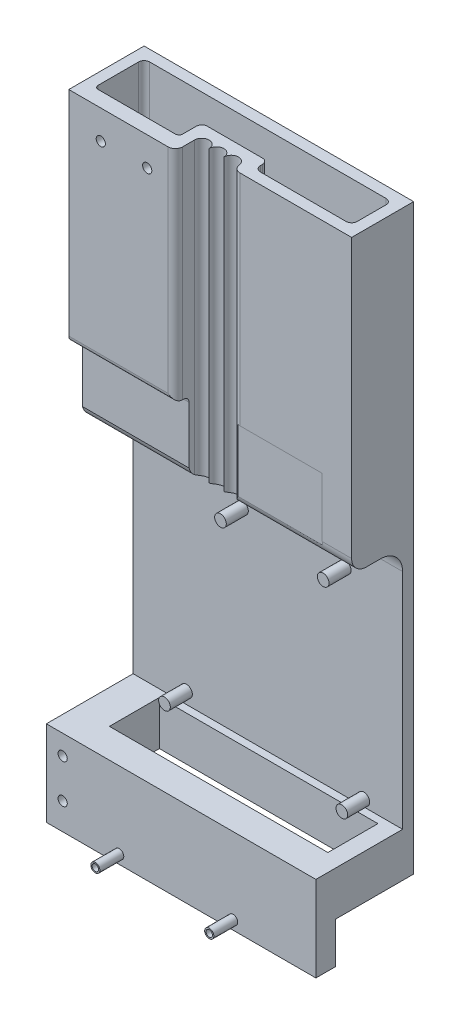
from build123d import *
from OCP.BRepAlgoAPI import BRepAlgoAPI_Cut
from OCP.TopTools import TopTools_ListOfShape

# Parameters (mm, degrees)
SKETCH1_W                      = 73.34
SKETCH1_H                      = 169.657257597
BOSS_EXTRUDE1_DEPTH            = 3
SKETCH9_W                      = 73.34
SKETCH9_H                      = 79.670461067
BOSS_EXTRUDE4_DEPTH            = 17.5
CUT_EXTRUDE1_DEPTH             = 173.631306068
CUT_EXTRUDE2_DEPTH             = 73.670461067
SKETCH12_W                     = 20.775343783
SKETCH12_H                     = 3.735015603
CUT_EXTRUDE3_DEPTH             = 76
FILLET1_START                  = -66
FILLET1_DEPTH                  = 75
FILLET1_START_2                = -65.34
FILLET1_2_DEPTH                = 29
FILLET1_3_DEPTH                = 75
FILLET1_4_DEPTH                = 73.34
FILLET1_START_3                = 79.469382503
FILLET1_5_DEPTH                = 79.530617497
SKETCH13_W                     = 73.34
SKETCH13_H                     = 23.237135262
BOSS_EXTRUDE5_DEPTH            = 26.6
CUT_EXTRUDE4_DEPTH             = 177.630455701
CUT_EXTRUDE4_DEPTH_BACK        = 177.630455701
SKETCH14_W                     = 21.32937166
SKETCH14_H                     = 11.18958823
SKETCH18_W                     = 59.458192731
SKETCH18_H                     = 13.611975131
CUT_EXTRUDE5_DEPTH             = 15.5
BOSS_EXTRUDE6_START            = -8.965684
SKETCH20_R                     = 1.23951459
BOSS_EXTRUDE6_DEPTH            = 6.5
SKETCH20_R_2                   = 1.25
BOSS_EXTRUDE6_2_DEPTH          = 6.5
SKETCH2_R                      = 1.5875
SKETCH2_R_2                    = 1.58375263
BOSS_EXTRUDE7_DEPTH            = 6
M3X0_5_TAPPED_HOLE1_AT_2_COUNT = 2
M3X0_5_TAPPED_HOLE1_AT_2_PITCH = 10.583256094
M3X0_5_TAPPED_HOLE2_AT_2_COUNT = 2
M3X0_5_TAPPED_HOLE2_AT_2_PITCH = 12.630996486


with BuildPart() as part:
    # Sketch1 → Boss-Extrude1 (new body)
    with BuildSketch(Plane.XY):
        with Locations((-28.67, 73.639040569)):
            Rectangle(SKETCH1_W, SKETCH1_H)
    extrude(amount=BOSS_EXTRUDE1_DEPTH)

    # Sketch9 → Boss-Extrude4 (add)
    with BuildSketch(Plane.XY.offset(3)):
        with Locations((-28.67, 118.632438834)):
            Rectangle(SKETCH9_W, SKETCH9_H)
    extrude(amount=BOSS_EXTRUDE4_DEPTH)

    # Sketch10 → Cut-Extrude1 (cut, through all)
    with BuildSketch(Plane.XZ):
        with BuildLine():
            ThreePointArc((-32.34, 15.308727806), (-30.34, 13.308727806), (-28.34, 15.308727806))
            ThreePointArc((-28.34, 15.308727806), (-26.34, 13.308727806), (-24.34, 15.308727806))
            Line((-24.34, 15.308727806), (-24.34, 16.87))
            Line((-24.34, 16.87), (8, 16.87))
            Line((8, 16.87), (8, 20.5))
            Line((8, 20.5), (-36.34, 20.5))
            Line((-36.34, 20.5), (-36.34, 16.87))
            Line((-36.34, 16.87), (-36.34, 15.308727806))
            ThreePointArc((-36.34, 15.308727806), (-34.34, 13.308727806), (-32.34, 15.308727806))
        make_face()
    extrude(amount=-CUT_EXTRUDE1_DEPTH, mode=Mode.SUBTRACT)

    # Sketch11 → Cut-Extrude2 (cut)
    with BuildSketch(Plane(origin=(0, 158.467669367, 0), x_dir=(1, 0, 0), z_dir=(0, 1, 0))):
        with BuildLine():
            Line((-39.34, -3), (-60.84, -3))
            ThreePointArc((-60.84, -3), (-61.900660172, -3.439339828), (-62.34, -4.5))
            Line((-62.34, -4.5), (-62.34, -15.5))
            ThreePointArc((-62.34, -15.5), (-62.047106781, -16.207106781), (-61.34, -16.5))
            Line((-61.34, -16.5), (-40.34, -16.5))
            ThreePointArc((-40.34, -16.5), (-39.632893219, -16.207106781), (-39.34, -15.5))
            Line((-39.34, -15.5), (-39.34, -11.808727806))
            ThreePointArc((-39.34, -11.808727806), (-38.900660172, -10.748067634), (-37.84, -10.308727806))
            Line((-37.84, -10.308727806), (-22.84, -10.308727806))
            ThreePointArc((-22.84, -10.308727806), (-21.779339828, -10.748067634), (-21.34, -11.808727806))
            Line((-21.34, -11.808727806), (-21.34, -12.37))
            ThreePointArc((-21.34, -12.37), (-20.900660172, -13.430660172), (-19.84, -13.87))
            Line((-19.84, -13.87), (3.5, -13.87))
            ThreePointArc((3.5, -13.87), (4.560660172, -13.430660172), (5, -12.37))
            Line((5, -12.37), (5, -4.5))
            ThreePointArc((5, -4.5), (4.560660172, -3.439339828), (3.5, -3))
            Line((3.5, -3), (-21.34, -3))
            Line((-21.34, -3), (-39.34, -3))
        make_face()
    extrude(amount=-CUT_EXTRUDE2_DEPTH, mode=Mode.SUBTRACT)

    # Sketch12 → Cut-Extrude3 (cut)
    with BuildSketch(Plane.YZ):
        with Locations((88.482016522, 18.632492199)):
            Rectangle(SKETCH12_W, SKETCH12_H)
    extrude(amount=-CUT_EXTRUDE3_DEPTH, mode=Mode.SUBTRACT)

    # Fillet1: read off the stored shape, not the designer's step
    # Fillet1 outline → Fillet1 (cut)
    with BuildSketch(Plane.YZ.offset(FILLET1_START)):
        with BuildLine():
            Line((78.7972083, 16.764984397), (78.7972083, 12.87))
            ThreePointArc((78.7972083, 12.87), (79.663345702, 15.355740377), (81.886660911, 16.764984397))
            Line((81.886660911, 16.764984397), (78.7972083, 16.764984397))
        make_face()
    extrude(amount=FILLET1_DEPTH, mode=Mode.SUBTRACT)

    # Fillet1 2 outline → Fillet1 2 (add)
    with BuildSketch(Plane.YZ.offset(FILLET1_START_2)):
        with BuildLine():
            ThreePointArc((98.869688413, 18.264984397), (98.430348584, 17.204324226), (97.369688413, 16.764984397))
            Line((97.369688413, 16.764984397), (98.869688413, 16.764984397))
            Line((98.869688413, 16.764984397), (98.869688413, 18.264984397))
        make_face()
    extrude(amount=FILLET1_2_DEPTH)

    # Fillet1 3 outline → Fillet1 3 (cut)
    with BuildSketch(Plane.YZ.offset(FILLET1_START)):
        with BuildLine():
            ThreePointArc((98.869688413, 19), (99.309028241, 20.060660172), (100.369688413, 20.5))
            Line((100.369688413, 20.5), (98.869688413, 20.5))
            Line((98.869688413, 20.5), (98.869688413, 19))
        make_face()
        with BuildLine():
            Line((78.7972083, 16.764984397), (81.886660911, 16.764984397))
            ThreePointArc((81.886660911, 16.764984397), (82.338916683, 16.843659371), (82.7972083, 16.87))
            Line((82.7972083, 16.87), (78.7972083, 16.87))
            Line((78.7972083, 16.87), (78.7972083, 16.764984397))
        make_face()
    extrude(amount=FILLET1_3_DEPTH, mode=Mode.SUBTRACT)

    # Fillet1 4 outline → Fillet1 4 (add)
    with BuildSketch(Plane.YZ.offset(FILLET1_START_2)):
        with BuildLine():
            Line((78.7972083, 3), (78.7972083, 9))
            ThreePointArc((78.7972083, 9), (77.039848987, 4.757359313), (72.7972083, 3))
            Line((72.7972083, 3), (78.7972083, 3))
        make_face()
    extrude(amount=FILLET1_4_DEPTH)

    # Fillet1 5 outline → Fillet1 5 (cut)
    with BuildSketch(Plane(origin=(0, 0, 0), x_dir=(1, 0, 0), z_dir=(0, 1, 0)).offset(FILLET1_START_3)):
        with BuildLine():
            Line((-24.34, -16.87), (-22.364133062, -16.87))
            ThreePointArc((-22.364133062, -16.87), (-23.698537771, -16.359753024), (-24.352066512, -15.089364072))
            ThreePointArc((-24.352066512, -15.089364072), (-24.343018906, -15.198880129), (-24.34, -15.308727806))
            Line((-24.34, -15.308727806), (-24.34, -16.87))
        make_face()
        with BuildLine():
            ThreePointArc((-36.34, -18.5), (-36.925786438, -19.914213562), (-38.34, -20.5))
            Line((-38.34, -20.5), (-36.34, -20.5))
            Line((-36.34, -20.5), (-36.34, -18.5))
        make_face()
    extrude(amount=FILLET1_5_DEPTH, mode=Mode.SUBTRACT)

    # Sketch13 → Boss-Extrude5 (add)
    with BuildSketch(Plane.XY):
        with Locations((-28.67, 0.428979401)):
            Rectangle(SKETCH13_W, SKETCH13_H)
    extrude(amount=BOSS_EXTRUDE5_DEPTH)

    # Sketch14 → Cut-Extrude4 (cut, two sides: drawn at the far end of the back side and taken through both)
    with BuildSketch(Plane(origin=(8, 0, 0), x_dir=(0, 0, -1), z_dir=(1, 0, 0)).offset(-CUT_EXTRUDE4_DEPTH_BACK)):
        with Locations((-10.66468583, -5.594794115)):
            Rectangle(SKETCH14_W, SKETCH14_H)
    extrude(amount=CUT_EXTRUDE4_DEPTH + CUT_EXTRUDE4_DEPTH_BACK, mode=Mode.SUBTRACT)

    # Sketch18 → Cut-Extrude5 (cut)
    with BuildSketch(Plane(origin=(0, 0, 0), x_dir=(-1, 0, 0), z_dir=(0, -1, 0))):
        with Locations((26.427356062, -11.823696784)):
            Rectangle(SKETCH18_W, SKETCH18_H)
    extrude(amount=-CUT_EXTRUDE5_DEPTH, mode=Mode.SUBTRACT)


with BuildPart() as body_2:
    # Sketch20 → Boss-Extrude6 (new body)
    with BuildSketch(Plane.XY.offset(35.565684349).offset(BOSS_EXTRUDE6_START)):
        with Locations(Location((-45.512465678, -8.699989093, 0), (0, 0, 180))):
            Circle(SKETCH20_R)
    extrude(amount=BOSS_EXTRUDE6_DEPTH)


with BuildPart() as body_3:
    # Sketch20 → Boss-Extrude6 2 (new body)
    with BuildSketch(Plane.XY.offset(35.565684349).offset(BOSS_EXTRUDE6_START)):
        with Locations(Location((-14.513794536, -8.68958823, 0), (0, 0, 180))):
            Circle(SKETCH20_R_2)
    extrude(amount=BOSS_EXTRUDE6_2_DEPTH)


with BuildPart() as m2_2x0_45_tapped_hole1_tool:
    # Sketch24 → M2.2x0.45 Tapped Hole1 (revolve)
    with BuildSketch(Plane(origin=(-45.512465678, -8.699989093, 33.1), x_dir=(0, -1, 0), z_dir=(1, 0, 0))):
        Polygon((0, 0), (0, 7.275753042), (0.875, 6.75), (0.875, 0), align=None)
    revolve(axis=Axis((-45.512465678, -8.699989093, 39.45), (0, 0, -1)))


with BuildPart() as body_2_1:
    add(body_2.part)

    # M2.2x0.45 Tapped Hole1: cut by m2_2x0_45_tapped_hole1_tool, with a tolerance
    m2_2x0_45_tapped_hole1_stock = TopTools_ListOfShape()
    m2_2x0_45_tapped_hole1_stock.Append(body_2_1.part.wrapped)
    m2_2x0_45_tapped_hole1_tools = TopTools_ListOfShape()
    m2_2x0_45_tapped_hole1_tools.Append(m2_2x0_45_tapped_hole1_tool.part.wrapped)
    m2_2x0_45_tapped_hole1_cut = BRepAlgoAPI_Cut()
    m2_2x0_45_tapped_hole1_cut.SetArguments(m2_2x0_45_tapped_hole1_stock)
    m2_2x0_45_tapped_hole1_cut.SetTools(m2_2x0_45_tapped_hole1_tools)
    m2_2x0_45_tapped_hole1_cut.SetFuzzyValue(0.00001)
    m2_2x0_45_tapped_hole1_cut.Build()
    add(Compound.cast(m2_2x0_45_tapped_hole1_cut.Shape()).solids(), mode=Mode.REPLACE)


with BuildPart() as m2_2x0_45_tapped_hole2_tool:
    # Sketch27 → M2.2x0.45 Tapped Hole2 (revolve)
    with BuildSketch(Plane(origin=(-14.513794536, -8.68958823, 33.1), x_dir=(0, -1, 0), z_dir=(1, 0, 0))):
        Polygon((0, 0), (0, 7.275753042), (0.875, 6.75), (0.875, 0), align=None)
    revolve(axis=Axis((-14.513794536, -8.68958823, 39.45), (0, 0, -1)))


with BuildPart() as part_1:
    add(part.part)

    # M2.2x0.45 Tapped Hole2: cut by m2_2x0_45_tapped_hole2_tool, with a tolerance
    m2_2x0_45_tapped_hole2_stock = TopTools_ListOfShape()
    m2_2x0_45_tapped_hole2_stock.Append(part_1.part.wrapped)
    m2_2x0_45_tapped_hole2_tools = TopTools_ListOfShape()
    m2_2x0_45_tapped_hole2_tools.Append(m2_2x0_45_tapped_hole2_tool.part.wrapped)
    m2_2x0_45_tapped_hole2_cut = BRepAlgoAPI_Cut()
    m2_2x0_45_tapped_hole2_cut.SetArguments(m2_2x0_45_tapped_hole2_stock)
    m2_2x0_45_tapped_hole2_cut.SetTools(m2_2x0_45_tapped_hole2_tools)
    m2_2x0_45_tapped_hole2_cut.SetFuzzyValue(0.00001)
    m2_2x0_45_tapped_hole2_cut.Build()
    add(Compound.cast(m2_2x0_45_tapped_hole2_cut.Shape()).solids(), mode=Mode.REPLACE)

    # Sketch2 → Boss-Extrude7 (add)
    with BuildSketch(Plane.XY.offset(3)):
        with Locations((-2.54, 13.97)):
            Circle(SKETCH2_R)
        with Locations((-35.563579412, 66.03889068)):
            Circle(SKETCH2_R_2)
        with Locations((-50.8, 15.24)):
            Circle(SKETCH2_R)
        with Locations((-7.62, 66.04)):
            Circle(SKETCH2_R)
    extrude(amount=BOSS_EXTRUDE7_DEPTH)

    # Sketch29 → M3x0.5 Tapped Hole1 (revolve, cut)
    with BuildSketch(Plane(origin=(-60.900206077, 6.673342436, 26.6), x_dir=(0, -1, 0), z_dir=(1, 0, 0))):
        Polygon((0, 0), (0, 5.351075774), (1.25, 4.6), (1.25, 0), align=None)
    m3x0_5_tapped_hole1 = revolve(axis=Axis((-60.900206077, 6.673342436, 32.95), (0, 0, -1)), mode=Mode.SUBTRACT)

    # M3x0.5 Tapped Hole1 at 2: M3x0.5 Tapped Hole1 ×2
    with Locations(*[(0, -i * M3X0_5_TAPPED_HOLE1_AT_2_PITCH, 0) for i in range(1, M3X0_5_TAPPED_HOLE1_AT_2_COUNT)]):
        add(m3x0_5_tapped_hole1, mode=Mode.SUBTRACT)

    # Sketch32 → M3x0.5 Tapped Hole2 (revolve, cut)
    with BuildSketch(Plane(origin=(-56.6297997, 150.625949834, 20.5), x_dir=(0, -1, 0), z_dir=(1, 0, 0))):
        Polygon((0, 0), (0, 5.351075774), (1.25, 4.6), (1.25, 0), align=None)
    m3x0_5_tapped_hole2 = revolve(axis=Axis((-56.6297997, 150.625949834, 26.85), (0, 0, -1)), mode=Mode.SUBTRACT)

    # M3x0.5 Tapped Hole2 at 2: M3x0.5 Tapped Hole2 ×2
    with Locations(*[(i * M3X0_5_TAPPED_HOLE2_AT_2_PITCH, 0, 0) for i in range(1, M3X0_5_TAPPED_HOLE2_AT_2_COUNT)]):
        add(m3x0_5_tapped_hole2, mode=Mode.SUBTRACT)


with BuildPart() as body_3_1:
    add(body_3.part)

    # M2.2x0.45 Tapped Hole2: cut by m2_2x0_45_tapped_hole2_tool, with a tolerance
    m2_2x0_45_tapped_hole2_2_stock = TopTools_ListOfShape()
    m2_2x0_45_tapped_hole2_2_stock.Append(body_3_1.part.wrapped)
    m2_2x0_45_tapped_hole2_2_tools = TopTools_ListOfShape()
    m2_2x0_45_tapped_hole2_2_tools.Append(m2_2x0_45_tapped_hole2_tool.part.wrapped)
    m2_2x0_45_tapped_hole2_2_cut = BRepAlgoAPI_Cut()
    m2_2x0_45_tapped_hole2_2_cut.SetArguments(m2_2x0_45_tapped_hole2_2_stock)
    m2_2x0_45_tapped_hole2_2_cut.SetTools(m2_2x0_45_tapped_hole2_2_tools)
    m2_2x0_45_tapped_hole2_2_cut.SetFuzzyValue(0.00001)
    m2_2x0_45_tapped_hole2_2_cut.Build()
    add(Compound.cast(m2_2x0_45_tapped_hole2_2_cut.Shape()).solids(), mode=Mode.REPLACE)


solid = Compound([body_2_1.part, part_1.part, body_3_1.part])
